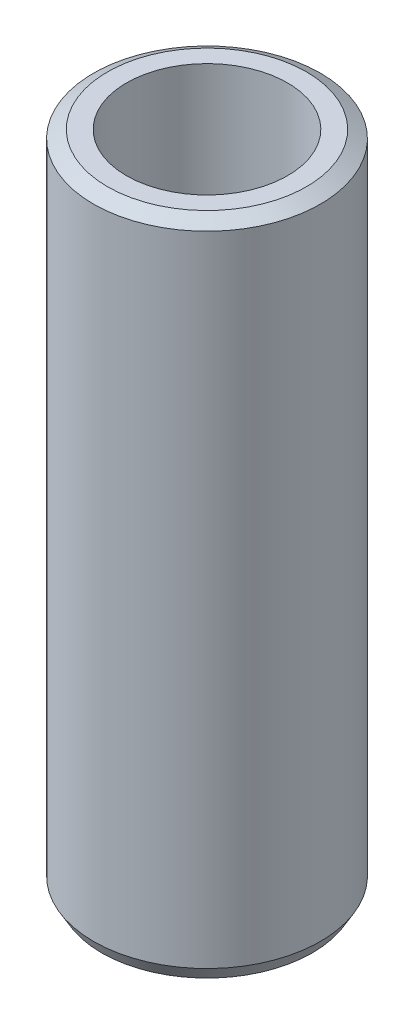
from build123d import *
from OCP.BRepFilletAPI import BRepFilletAPI_MakeChamfer

# Parameters (mm, degrees)
SKETCH1_R           = 30
BOSS_EXTRUDE1_DEPTH = 174.641646215
SKETCH2_R           = 21.286147697
CUT_EXTRUDE1_DEPTH  = 180.721185709
CHAMFER1_SIZE       = 2.133040765
CHAMFER1_SIZE2      = 3.694534979


with BuildPart() as part:
    # Sketch1 → Boss-Extrude1 (new body)
    with BuildSketch(Plane(origin=(0, 0, 0), x_dir=(1, 0, 0), z_dir=(0, 1, 0))):
        Circle(SKETCH1_R)
    extrude(amount=BOSS_EXTRUDE1_DEPTH)

    # Sketch2 → Cut-Extrude1 (cut, through all)
    with BuildSketch(Plane(origin=(0, 0, 0), x_dir=(1, 0, 0), z_dir=(0, 1, 0))):
        Circle(SKETCH2_R)
    extrude(amount=CUT_EXTRUDE1_DEPTH, mode=Mode.SUBTRACT)

    # Chamfer1: one chamfer whose edges measure the first distance from different faces: ONE call of the kernel's chamfer builder (chamfer() names one face for all edges)
    chamfer1_edges_1 = [part.edges().sort_by_distance(p)[0] for p in [
        (-30, 174.641646215, 0),
    ]]
    chamfer1_side_1 = [part.faces().sort_by_distance(p)[0] for p in [
        (-30, 87.320823108, 0),
    ]]
    chamfer1_edges_2 = [part.edges().sort_by_distance(p)[0] for p in [
        (-30, 0, 0),
    ]]
    chamfer1_side_2 = [part.faces().sort_by_distance(p)[0] for p in [
        (-29.151471863, 0, 0),
    ]]
    chamfer1 = BRepFilletAPI_MakeChamfer(part.part.solid().wrapped)
    for e in chamfer1_edges_1:
        chamfer1.Add(CHAMFER1_SIZE, CHAMFER1_SIZE2, e.wrapped, chamfer1_side_1[0].wrapped)  # the first distance lies on this face
    for e in chamfer1_edges_2:
        chamfer1.Add(CHAMFER1_SIZE, CHAMFER1_SIZE2, e.wrapped, chamfer1_side_2[0].wrapped)  # the first distance lies on this face
    add(Compound.cast(chamfer1.Shape()), mode=Mode.REPLACE)


solid = part.part
